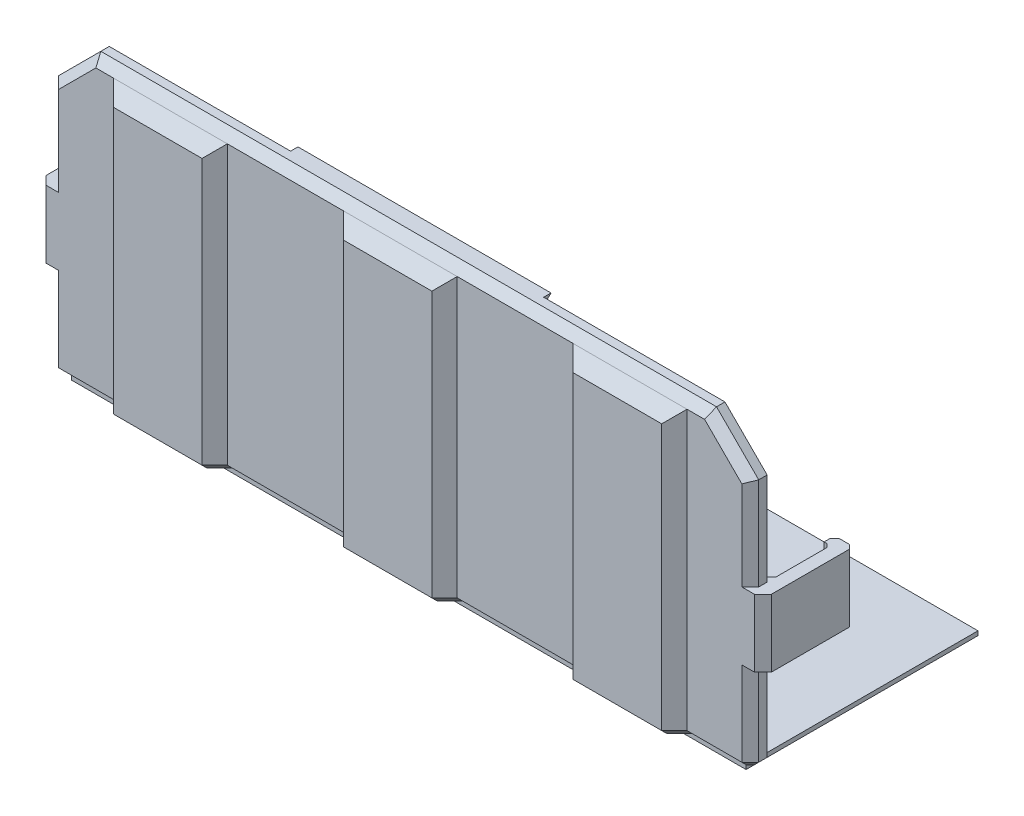
from build123d import *

# Parameters (mm, degrees)
SKETCH1_W           = 166
SKETCH1_H           = 70
BOSS_EXTRUDE1_DEPTH = 4
CHAMFER1_SIZE       = 10
CHAMFER2_SIZE       = 2
BOSS_EXTRUDE2_DEPTH = 68
CHAMFER3_SIZE       = 3
SKETCH3_W           = 160
SKETCH3_H           = 55
BOSS_EXTRUDE3_DEPTH = 3
CHAMFER4_SIZE       = 2
BOSS_EXTRUDE4_DEPTH = 140
BOSS_EXTRUDE5_DEPTH = 16
CHAMFER5_SIZE       = 0.75
CHAMFER6_SIZE       = 2
CHAMFER7_SIZE       = 2
BOSS_EXTRUDE6_DEPTH = 30


with BuildPart() as part:
    # Sketch1 → Boss-Extrude1 (new body)
    with BuildSketch(Plane.XY):
        with Locations((0, -35)):
            Rectangle(SKETCH1_W, SKETCH1_H)
    extrude(amount=BOSS_EXTRUDE1_DEPTH)

    # Chamfer1
    chamfer1_edges = [part.edges().sort_by_distance(p)[0] for p in [
        (-83, 0, 2),
        (83, 0, 2),
    ]]
    chamfer(chamfer1_edges, length=CHAMFER1_SIZE)

    # Chamfer2
    chamfer2_edges = [part.edges().sort_by_distance(p)[0] for p in [
        (-83, -40, 4),
        (0, 0, 4),
        (78, -5, 4),
        (-78, -5, 4),
        (83, -40, 4),
    ]]
    chamfer(chamfer2_edges, length=CHAMFER2_SIZE)

    # Sketch2 → Boss-Extrude2 (add)
    with BuildSketch(Plane(origin=(0, -70, 0), x_dir=(-1, 0, 0), z_dir=(0, -1, 0))):
        Polygon((68, -4), (65, -7), (44, -7), (41, -4), align=None)
        Polygon((13.5, -4), (-13.5, -4), (-10.5, -7), (10.5, -7), align=None)
        Polygon((-41, -4), (-44, -7), (-65, -7), (-68, -4), align=None)
    extrude(amount=-BOSS_EXTRUDE2_DEPTH)

    # Chamfer3
    chamfer3_edges = [part.edges().sort_by_distance(p)[0] for p in [
        (54.5, -2, 7),
        (0, -2, 7),
        (-54.5, -2, 7),
    ]]
    chamfer(chamfer3_edges, length=CHAMFER3_SIZE - 0.0001)  # a hair under: the kernel refuses the full size

    # Sketch3 → Boss-Extrude3 (add)
    with BuildSketch(Plane(origin=(0, -70, 0), x_dir=(-1, 0, 0), z_dir=(0, -1, 0))):
        with Locations((0, 25.5)):
            Rectangle(SKETCH3_W, SKETCH3_H)
    extrude(amount=BOSS_EXTRUDE3_DEPTH)

    # Chamfer4
    chamfer4_edges = [part.edges().sort_by_distance(p)[0] for p in [
        (80, -73, -25.5),
        (0, -73, 2),
        (-80, -73, -25.5),
    ]]
    chamfer(chamfer4_edges, length=CHAMFER4_SIZE)

    # Sketch4 → Boss-Extrude4 (add)
    with BuildSketch(Plane.ZY.offset(70)):
        Polygon((0, -70), (0, -65), (-5, -70), align=None)
    extrude(amount=-BOSS_EXTRUDE4_DEPTH)

    # Sketch5 → Boss-Extrude5 (add)
    with BuildSketch(Plane(origin=(0, -48, 0), x_dir=(-1, 0, 0), z_dir=(0, -1, 0))):
        Polygon((-81, -4), (-83, -2), (-83, 15), (-81.5, 15), (-81.5, 16.5), (-82.5, 17.5), (-85, 17.5), (-86, 16.5), (-86, -2), (-84, -4), align=None)
        Polygon((81.5, 16.5), (82.5, 17.5), (85, 17.5), (86, 16.5), (86, -2), (84, -4), (81, -4), (83, -2), (83, 15), (81.5, 15), align=None)
    extrude(amount=-BOSS_EXTRUDE5_DEPTH)

    # Chamfer5
    chamfer5_edges = [part.edges().sort_by_distance(p)[0] for p in [
        (83, -40, -15),
        (-83, -40, -15),
    ]]
    chamfer(chamfer5_edges, length=CHAMFER5_SIZE)

    # Chamfer6
    chamfer6_edges = [part.edges().sort_by_distance(p)[0] for p in [
        (83, -40, 0),
        (-83, -40, 0),
    ]]
    chamfer(chamfer6_edges, length=CHAMFER6_SIZE)

    # Chamfer7
    chamfer7_edges = [part.edges().sort_by_distance(p)[0] for p in [
        (-74.5, -70, 4),
        (83, -70, 1),
        (-83, -70, 1),
        (-82, -70, 3),
        (82, -70, 3),
        (-27.25, -70, 4),
        (-42.5, -70, 5.5),
        (-54.5, -70, 7),
        (-66.5, -70, 5.5),
        (27.25, -70, 4),
        (-12, -70, 5.5),
        (12, -70, 5.5),
        (0, -70, 7),
        (74.5, -70, 4),
        (66.5, -70, 5.5),
        (54.5, -70, 7),
        (42.5, -70, 5.5),
    ]]
    chamfer(chamfer7_edges, length=CHAMFER7_SIZE - 0.0001)  # a hair under: the kernel refuses the full size

    # Sketch6 → Boss-Extrude6 (add, symmetric)
    with BuildSketch(Plane(origin=(0, 0, 0), x_dir=(0, 0, -1), z_dir=(1, 0, 0))):
        Polygon((0, -1.75), (1.75, 0), (0, 0), align=None)
    extrude(amount=BOSS_EXTRUDE6_DEPTH, both=True)


solid = part.part
